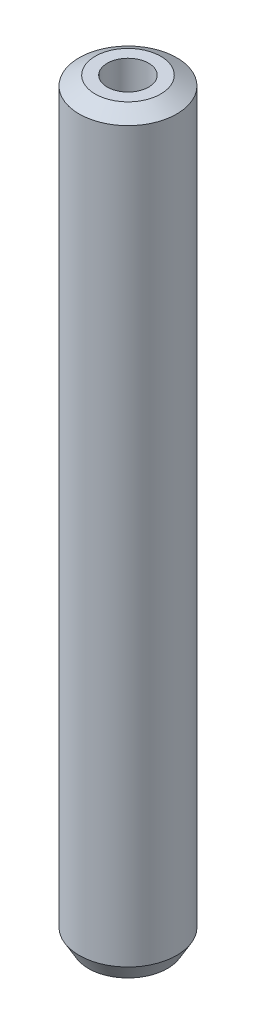
from build123d import *
from OCP.BRepFilletAPI import BRepFilletAPI_MakeChamfer

# Parameters (mm, degrees)
SKETCH1_R           = 15
BOSS_EXTRUDE1_DEPTH = 231.760429466
SKETCH2_R           = 6.36779097
CUT_EXTRUDE1_DEPTH  = 233.729234662
CHAMFER1_SIZE       = 2.848400003
CHAMFER1_SIZE2      = 4.933573526


with BuildPart() as part:
    # Sketch1 → Boss-Extrude1 (new body)
    with BuildSketch(Plane(origin=(0, 0, 0), x_dir=(1, 0, 0), z_dir=(0, 1, 0))):
        Circle(SKETCH1_R)
    extrude(amount=BOSS_EXTRUDE1_DEPTH)

    # Sketch2 → Cut-Extrude1 (cut, through all)
    with BuildSketch(Plane(origin=(0, 0, 0), x_dir=(1, 0, 0), z_dir=(0, 1, 0))):
        Circle(SKETCH2_R)
    extrude(amount=CUT_EXTRUDE1_DEPTH, mode=Mode.SUBTRACT)

    # Chamfer1: one chamfer whose edges measure the first distance from different faces: ONE call of the kernel's chamfer builder (chamfer() names one face for all edges)
    chamfer1_edges_1 = [part.edges().sort_by_distance(p)[0] for p in [
        (-15, 231.760429466, 0),
    ]]
    chamfer1_side_1 = [part.faces().sort_by_distance(p)[0] for p in [
        (-15, 115.880214733, 0),
    ]]
    chamfer1_edges_2 = [part.edges().sort_by_distance(p)[0] for p in [
        (-15, 0, 0),
    ]]
    chamfer1_side_2 = [part.faces().sort_by_distance(p)[0] for p in [
        (-14.575735931, 0, 0),
    ]]
    chamfer1 = BRepFilletAPI_MakeChamfer(part.part.solid().wrapped)
    for e in chamfer1_edges_1:
        chamfer1.Add(CHAMFER1_SIZE, CHAMFER1_SIZE2, e.wrapped, chamfer1_side_1[0].wrapped)  # the first distance lies on this face
    for e in chamfer1_edges_2:
        chamfer1.Add(CHAMFER1_SIZE, CHAMFER1_SIZE2, e.wrapped, chamfer1_side_2[0].wrapped)  # the first distance lies on this face
    add(Compound.cast(chamfer1.Shape()), mode=Mode.REPLACE)


solid = part.part
